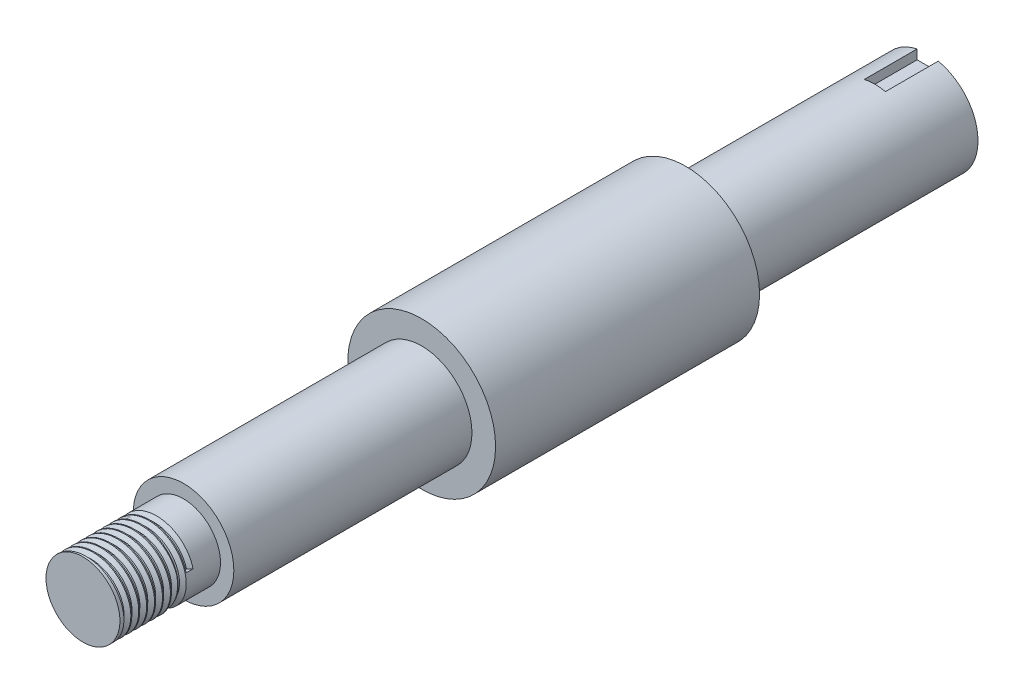
from build123d import *

# Parameters (mm, degrees)
CHUCK_THREAD_PITCH   = 1.5
THREAD_SLOT_SKETCH_R = 0.5
SKETCH_KEY_W         = 4
SKETCH_KEY_H         = 2
KEY_CUT_DEPTH        = 10


with BuildPart() as part:
    # Sketch Spindle Skeleton one side → Revolve Spindle (revolve)
    with BuildSketch(Plane(origin=(0, 0, 0), x_dir=(0, 0, -1), z_dir=(1, 0, 0)), mode=Mode.PRIVATE) as revolve_spindle_sk:
        Polygon((-160.00000004, 7), (-160.00000004, 0), (0, 0), (0, 9.525), (-45.847, 9.525), (-45.847, 13.99999994), (-95.847000076, 13.99999994), (-95.847000076, 9.525), (-140.95000004, 9.525), (-140.95000004, 7), align=None)
    revolve(revolve_spindle_sk.sketch.rotate(Axis((0, 0, 1000), (0, 0, -1)), 90), axis=Axis((0, 0, 1000), (0, 0, -1)))

    # Chuck Thread: the profile of Thread Profile2 profile screwed along a right-hand helix of 8.466667 turns, 8 arcs to a turn; built about Z, then put on its axis
    chuck_thread_z = Axis((0, 0, 0), (0, 0, 1))
    chuck_thread_corners = [(7.0003, 0, -0.000173205), (7.0003, 0, 1.312673201), (6.188101187, 0, 0.843749998), (6.188101187, 0, 0.468749998)]
    with BuildLine(mode=Mode.PRIVATE) as chuck_thread_profile:
        Line(chuck_thread_corners[0], chuck_thread_corners[1])
        Line(chuck_thread_corners[1], chuck_thread_corners[2])
        Line(chuck_thread_corners[2], chuck_thread_corners[3])
        Line(chuck_thread_corners[3], chuck_thread_corners[0])
    chuck_thread_cap = Face(chuck_thread_profile.wire())
    chuck_thread_turn_angles = [0, 22.5, 45, 67.5, 90, 112.5, 135, 157.5, 180, 202.5, 225, 247.5, 270, 292.5, 315, 337.5, 360]
    chuck_thread_turn_weights = [1, 0.9238795325112867, 1, 0.9238795325112867, 1, 0.9238795325112867, 1, 0.9238795325112867, 1, 0.9238795325112867, 1, 0.9238795325112867, 1, 0.9238795325112867, 1, 0.9238795325112867, 1]
    chuck_thread_turn_rails = [Edge.make_bspline([Vector(p[0], p[1], 0).rotate(chuck_thread_z, chuck_thread_turn_angles[k]) / chuck_thread_turn_weights[k] + Vector(0, 0, p[2] + CHUCK_THREAD_PITCH * chuck_thread_turn_angles[k] / 360) for k in range(17)], [0, 0, 0, 1, 1, 2, 2, 3, 3, 4, 4, 5, 5, 6, 6, 7, 7, 8, 8, 8], 2, chuck_thread_turn_weights) for p in chuck_thread_corners]
    chuck_thread_turn_sides = [Face.make_surface_from_curves(chuck_thread_turn_rails[p[0]], chuck_thread_turn_rails[p[1]]) for p in [(0, 1), (1, 2), (2, 3), (3, 0)]]
    chuck_thread_last_angles = [2880, 2902.5, 2925, 2947.5, 2970, 2992.5, 3015, 3031.5, 3048]
    chuck_thread_last_weights = [1, 0.9238795325112867, 1, 0.9238795325112867, 1, 0.9238795325112867, 1, 0.9588197348681942, 1]
    chuck_thread_last_rails = [Edge.make_bspline([Vector(p[0], p[1], 0).rotate(chuck_thread_z, chuck_thread_last_angles[k]) / chuck_thread_last_weights[k] + Vector(0, 0, p[2] + CHUCK_THREAD_PITCH * chuck_thread_last_angles[k] / 360) for k in range(9)], [0, 0, 0, 1, 1, 2, 2, 3, 3, 4, 4, 4], 2, chuck_thread_last_weights) for p in chuck_thread_corners]
    chuck_thread_last_sides = [Face.make_surface_from_curves(chuck_thread_last_rails[p[0]], chuck_thread_last_rails[p[1]]) for p in [(0, 1), (1, 2), (2, 3), (3, 0)]]
    chuck_thread = Plane(origin=(0, 0, 160.00000004), x_dir=(-1, 0, 0), z_dir=(0, 0, -1)) * Solid(Shell([*[p.moved(Location((0, 0, CHUCK_THREAD_PITCH * i))) for i in range(8) for p in chuck_thread_turn_sides], *chuck_thread_last_sides, chuck_thread_cap, chuck_thread_cap.rotate(chuck_thread_z, 3048).moved(Location((0, 0, CHUCK_THREAD_PITCH * 3048 / 360)))]))
    add(chuck_thread, mode=Mode.SUBTRACT)

    # Thread Slot Sketch → Thread Slot (revolve, cut)
    with BuildSketch(Plane(origin=(0, 0, 0), x_dir=(0, 0, -1), z_dir=(1, 0, 0)), mode=Mode.PRIVATE) as thread_slot_sk:
        with Locations((-148.50000004, 7)):
            Circle(THREAD_SLOT_SKETCH_R)
    revolve(thread_slot_sk.sketch.rotate(Axis((0, 0, 1000), (0, 0, -1)), 90), axis=Axis((0, 0, 1000), (0, 0, -1)), mode=Mode.SUBTRACT)

    # Sketch Key → Key Cut (cut)
    with BuildSketch(Plane(origin=(0, 0, 0), x_dir=(-1, 0, 0), z_dir=(0, 0, -1))):
        with Locations((0, 8.525)):
            Rectangle(SKETCH_KEY_W, SKETCH_KEY_H)
    extrude(amount=-KEY_CUT_DEPTH, mode=Mode.SUBTRACT)


solid = part.part
